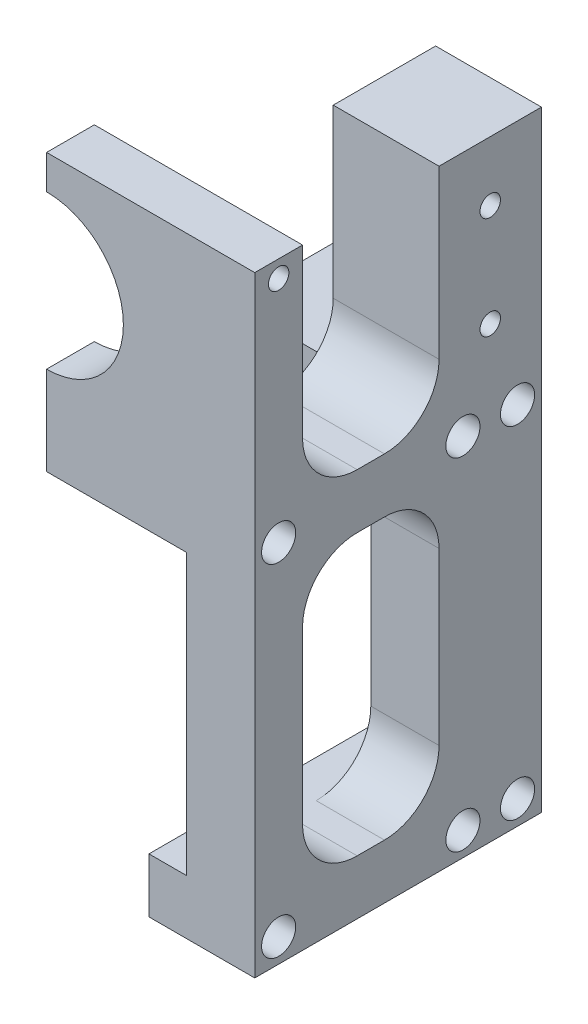
from build123d import *

# Parameters (mm, degrees)
BOSS_EXTRUDE1_DEPTH     = 19.05
CUT_EXTRUDE1_DEPTH      = 112.559578813
CUT_EXTRUDE1_DEPTH_BACK = 112.559578813
SKETCH2_R               = 1.905
BOSS_EXTRUDE2_START     = 25.4
BOSS_EXTRUDE2_DEPTH     = 8.89
SKETCH5_W               = 19.685
SKETCH5_H               = 10.16
BOSS_EXTRUDE4_DEPTH     = 34.29
CUT_EXTRUDE2_DEPTH      = 123.179346557
CUT_EXTRUDE2_DEPTH_BACK = 123.179346557
SKETCH6_R               = 3.175
CUT_EXTRUDE4_DEPTH      = 123.179346557
CUT_EXTRUDE4_DEPTH_BACK = 123.179346557
SKETCH9_R               = 3.175
FILLET1_R               = 10.16
CUT_EXTRUDE8_DEPTH      = 123.179346557
CUT_EXTRUDE8_DEPTH_BACK = 123.179346557
SKETCH14_R              = 1.905


with BuildPart() as part:
    # Sketch1 → Boss-Extrude1 (new body)
    with BuildSketch(Plane.XY):
        Polygon((44.45, -0.635), (44.45, -10.795), (64.135, -10.795), (64.135, 102.87), (44.45, 102.87), (44.45, 100.33), (44.45, 61.595), (25.4, 61.595), (25.4, 51.435), (51.435, 51.435), (51.435, -0.635), align=None)
    extrude(amount=BOSS_EXTRUDE1_DEPTH)

    # Sketch2 → Cut-Extrude1 (cut, two sides: drawn at the far end of the back side and taken through both)
    with BuildSketch(Plane(origin=(64.135, 0, 0), x_dir=(0, 0, -1), z_dir=(1, 0, 0)).offset(-CUT_EXTRUDE1_DEPTH_BACK)):
        with Locations((-9.525, 91.7575)):
            Circle(SKETCH2_R)
        with Locations((-9.525, 72.7075)):
            Circle(SKETCH2_R)
    extrude(amount=CUT_EXTRUDE1_DEPTH + CUT_EXTRUDE1_DEPTH_BACK, mode=Mode.SUBTRACT)



with BuildPart() as body_2:
    # Sketch3 → Boss-Extrude2 (new body)
    with BuildSketch(Plane.XY.offset(19.05).offset(BOSS_EXTRUDE2_START)):
        with BuildLine():
            Line((25.4, 96.52), (25.4, 102.87))
            Line((25.4, 102.87), (44.45, 102.87))
            Line((44.45, 102.87), (64.135, 102.87))
            Line((64.135, 102.87), (64.135, -10.795))
            Line((64.135, -10.795), (44.45, -10.795))
            Line((44.45, -10.795), (44.45, -0.635))
            Line((44.45, -0.635), (51.435, -0.635))
            Line((51.435, -0.635), (51.435, 51.435))
            Line((51.435, 51.435), (25.4, 51.435))
            Line((25.4, 51.435), (25.4, 61.595))
            Line((25.4, 61.595), (25.4, 67.945))
            ThreePointArc((25.4, 67.945), (39.6875, 82.2325), (25.4, 96.52))
        make_face()
    extrude(amount=BOSS_EXTRUDE2_DEPTH)


with BuildPart() as part_1:
    add(part.part)

    add(body_2.part)  # Boss-Extrude4 merges body 2
    # Sketch5 → Boss-Extrude4 (add)
    with BuildSketch(Plane.XY.offset(53.34)):
        with Locations((54.2925, -5.715)):
            Rectangle(SKETCH5_W, SKETCH5_H)
        with Locations((54.2925, 56.515)):
            Rectangle(SKETCH5_W, SKETCH5_H)
    extrude(amount=-BOSS_EXTRUDE4_DEPTH)

    # Sketch6 → Cut-Extrude2 (cut, two sides: drawn at the far end of the back side and taken through both)
    with BuildSketch(Plane(origin=(64.135, 0, 0), x_dir=(0, 0, -1), z_dir=(1, 0, 0)).offset(-CUT_EXTRUDE2_DEPTH_BACK)):
        with Locations((-14.605, 57.15)):
            Circle(SKETCH6_R)
        with Locations((-4.445, 57.15)):
            Circle(SKETCH6_R)
        with Locations((-14.605, -6.35)):
            Circle(SKETCH6_R)
        with Locations((-4.445, -6.35)):
            Circle(SKETCH6_R)
    extrude(amount=CUT_EXTRUDE2_DEPTH + CUT_EXTRUDE2_DEPTH_BACK, mode=Mode.SUBTRACT)

    # Sketch9 → Cut-Extrude4 (cut, two sides: drawn at the far end of the back side and taken through both)
    with BuildSketch(Plane(origin=(64.135, 0, 0), x_dir=(0, 0, -1), z_dir=(1, 0, 0)).offset(-CUT_EXTRUDE4_DEPTH_BACK)):
        with Locations((-48.895, 57.15)):
            Circle(SKETCH9_R)
        with Locations((-48.895, -6.35)):
            Circle(SKETCH9_R)
    extrude(amount=CUT_EXTRUDE4_DEPTH + CUT_EXTRUDE4_DEPTH_BACK, mode=Mode.SUBTRACT)

    # Fillet1
    # the kernel refuses this fillet: 10.16 mm, written as the material it adds along each edge
    with BuildSketch(Plane(origin=(44.45, 61.595, 19.05), x_dir=(0, 1, 0), z_dir=(1, 0, 0))) as fillet1_piece_1:
        with BuildLine():
            CenterArc((FILLET1_R, FILLET1_R), FILLET1_R, 180, 90)
            Line((0, FILLET1_R), (0, 0))
            Line((0, 0), (FILLET1_R, 0))
        make_face()
    extrude(amount=19.685)
    with BuildSketch(Plane(origin=(64.135, 51.435, 19.05), x_dir=(0, -1, 0), z_dir=(-1, 0, 0)), Plane(origin=(51.435, 51.435, 44.45), x_dir=(0, -1, 0), z_dir=(1, 0, 0))) as fillet1_piece_2:
        with BuildLine():
            CenterArc((FILLET1_R, FILLET1_R), FILLET1_R, 180, 90)
            Line((0, FILLET1_R), (0, 0))
            Line((0, 0), (FILLET1_R, 0))
        make_face()
    extrude(amount=12.7)
    with BuildSketch(Plane(origin=(64.135, 61.595, 44.45), x_dir=(0, 0, -1), z_dir=(-1, 0, 0))) as fillet1_piece_3:
        with BuildLine():
            CenterArc((FILLET1_R, -FILLET1_R), FILLET1_R, 90, 90)
            Line((0, -FILLET1_R), (0, 0))
            Line((0, 0), (FILLET1_R, 0))
        make_face()
    extrude(amount=19.685)
    with BuildSketch(Plane(origin=(64.135, -0.635, 44.45), x_dir=(0, 0, -1), z_dir=(-1, 0, 0)), Plane(origin=(51.435, -0.635, 19.05), x_dir=(0, 0, 1), z_dir=(1, 0, 0))) as fillet1_piece_4:
        with BuildLine():
            CenterArc((FILLET1_R, -FILLET1_R), FILLET1_R, 90, 90)
            Line((0, -FILLET1_R), (0, 0))
            Line((0, 0), (FILLET1_R, 0))
        make_face()
    extrude(amount=12.7)

    # Sketch14 → Cut-Extrude8 (cut, two sides: drawn at the far end of the back side and taken through both)
    with BuildSketch(Plane(origin=(64.135, 0, 0), x_dir=(0, 0, -1), z_dir=(1, 0, 0)).offset(-CUT_EXTRUDE8_DEPTH_BACK)):
        with Locations((-48.895, 99.695)):
            Circle(SKETCH14_R)
    extrude(amount=CUT_EXTRUDE8_DEPTH + CUT_EXTRUDE8_DEPTH_BACK, mode=Mode.SUBTRACT)


solid = part_1.part
